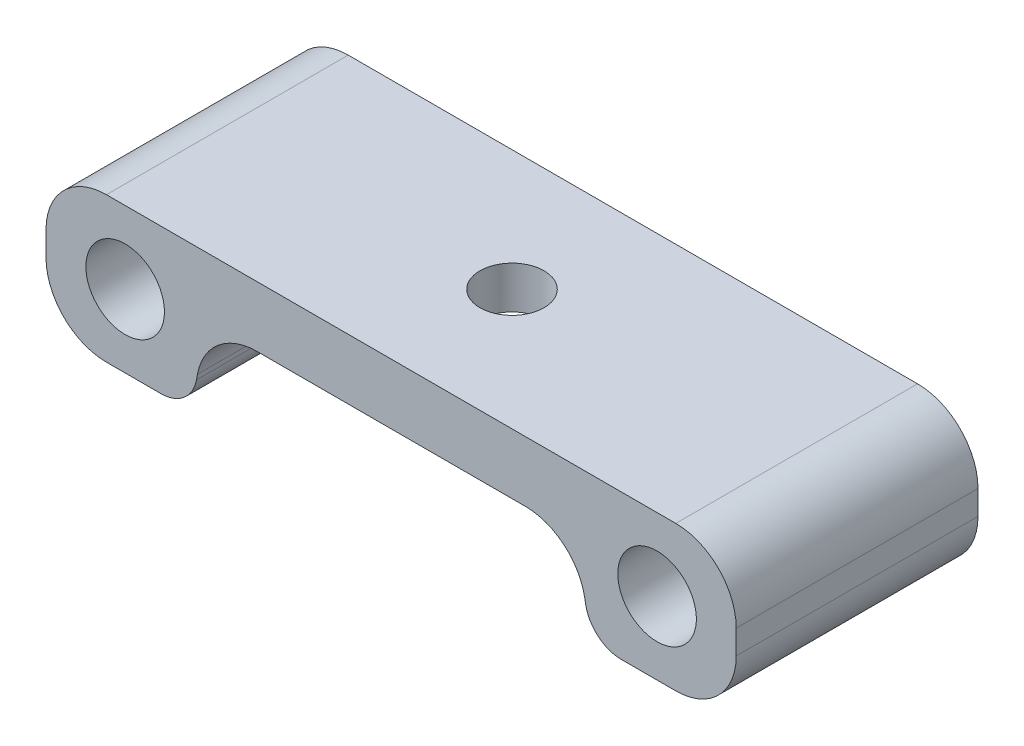
from build123d import *

# Parameters (mm, degrees)
ESQUISSE1_R             = 3.25
BOSS_EXTRU_1_DEPTH      = 10
CONG_1_R                = 5
CONG_2_R                = 3
ESQUISSE2_R             = 6
ENL_V_MAT_EXTRU_1_DEPTH = 1.5
ESQUISSE3_R             = 2.65
ENL_V_MAT_EXTRU_2_DEPTH = 33.542161529


with BuildPart() as part:
    # Esquisse1 → Boss.-Extru.1 (new, symmetric)
    with BuildSketch(Plane.XY):
        Polygon((0, 0), (-15.265735364, 0), (-16.548069585, -7), (-28.548069585, -7), (-28.548069585, 5), (0, 5), align=None)
        with Locations((-22, -1)):
            Circle(ESQUISSE1_R, mode=Mode.SUBTRACT)
    boss_extru_1 = extrude(amount=BOSS_EXTRU_1_DEPTH, both=True)

    # Symétrie1: Boss.-Extru.1 across plane
    add(boss_extru_1.mirror(Plane(origin=(0, 5, 10), x_dir=(0, 0, 1), z_dir=(-1, 0, 0))))

    # Congé1
    cong_1_edges = [part.edges().sort_by_distance(p)[0] for p in [
        (-15.265735364, 0, 0),
        (-28.548069585, -7, 0),
        (-28.548069585, 5, 0),
        (15.265735364, 0, 0),
        (28.548069585, -7, 0),
        (28.548069585, 5, 0),
    ]]
    fillet(cong_1_edges, radius=CONG_1_R)

    # Congé2
    cong_2_edges = [part.edges().sort_by_distance(p)[0] for p in [
        (-16.548069585, -7, 0),
        (16.548069585, -7, 0),
    ]]
    fillet(cong_2_edges, radius=CONG_2_R)

    # Esquisse2 → Enlèv. mat.-Extru.1 (cut)
    with BuildSketch(Plane.XZ):
        Circle(ESQUISSE2_R)
    extrude(amount=-ENL_V_MAT_EXTRU_1_DEPTH, mode=Mode.SUBTRACT)

    # Esquisse3 → Enlèv. mat.-Extru.2 (cut, through all)
    with BuildSketch(Plane(origin=(0, 5, 0), x_dir=(1, 0, 0), z_dir=(0, 1, 0))):
        Circle(ESQUISSE3_R)
    extrude(amount=-ENL_V_MAT_EXTRU_2_DEPTH, mode=Mode.SUBTRACT)


solid = part.part
